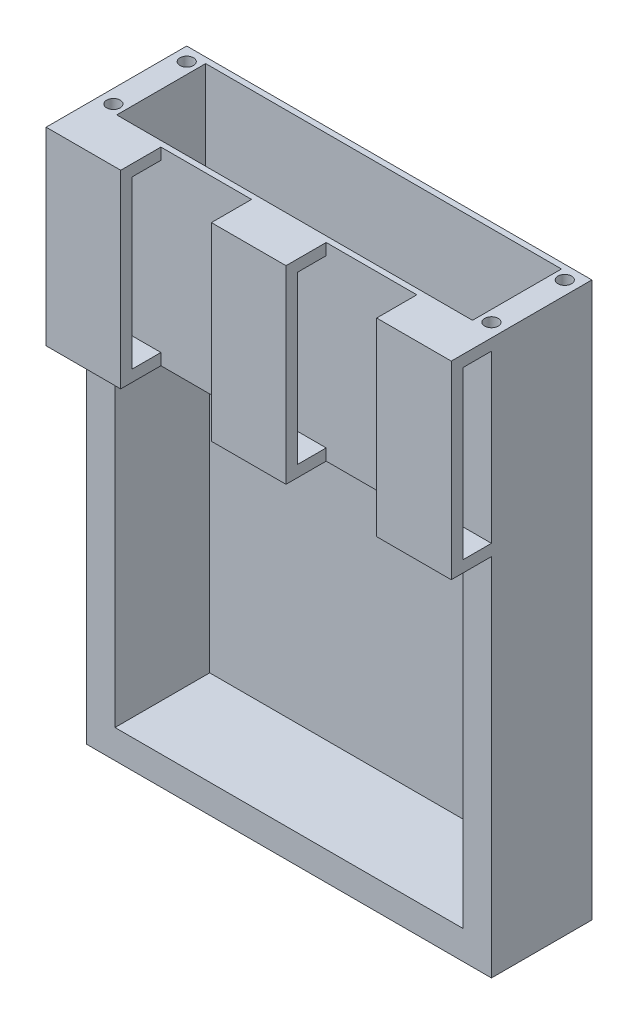
from build123d import *

# Parameters (mm, degrees)
SKETCH1_W           = 89.662
SKETCH1_H           = 22.225
BOSS_EXTRUDE1_DEPTH = 87.122
SKETCH2_W           = 76.962
SKETCH2_H           = 74.422
CUT_EXTRUDE1_DEPTH  = 20.955
SKETCH4_W           = 89.662
SKETCH4_H           = 22.225
SKETCH4_W_2         = 78.74
SKETCH4_H_2         = 19.685
BOSS_EXTRUDE2_DEPTH = 35.56
SKETCH5_R           = 3.175
SKETCH5_R_2         = 1.5
BOSS_EXTRUDE5_DEPTH = 1.27
SKETCH6_R           = 1.5
CUT_EXTRUDE4_DEPTH  = 19.05
SKETCH10_W          = 16.51
SKETCH10_H          = 41.91
BOSS_EXTRUDE4_DEPTH = 8.89
SKETCH11_W          = 6.35
SKETCH11_H          = 36.83
CUT_EXTRUDE8_DEPTH  = 154.571149612


with BuildPart() as part:
    # Sketch1 → Boss-Extrude1 (new body)
    with BuildSketch(Plane(origin=(0, 0, 0), x_dir=(1, 0, 0), z_dir=(0, 1, 0))):
        with Locations((44.831, 11.1125)):
            Rectangle(SKETCH1_W, SKETCH1_H)
    extrude(amount=BOSS_EXTRUDE1_DEPTH)

    # Sketch2 → Cut-Extrude1 (cut)
    with BuildSketch(Plane.XY):
        with Locations((44.831, 43.561)):
            Rectangle(SKETCH2_W, SKETCH2_H)
    extrude(amount=-CUT_EXTRUDE1_DEPTH, mode=Mode.SUBTRACT)

    # Sketch4 → Boss-Extrude2 (add)
    with BuildSketch(Plane(origin=(0, 87.122, 0), x_dir=(1, 0, 0), z_dir=(0, 1, 0))):
        with Locations((44.831, 11.1125)):
            Rectangle(SKETCH4_W, SKETCH4_H)
        with Locations((44.831, 11.1125)):
            Rectangle(SKETCH4_W_2, SKETCH4_H_2, mode=Mode.SUBTRACT)
    extrude(amount=BOSS_EXTRUDE2_DEPTH)

    # Sketch5 → Boss-Extrude5 (add)
    # profile 1 of 4: a face of its own
    with BuildSketch(Plane(origin=(0, 88.392, -1.27), x_dir=(1, 0, 0), z_dir=(0, 0, -1))):
        with Locations((18.161, -26.02738)):
            Circle(SKETCH5_R)
        with Locations((18.161, -26.02738)):
            Circle(SKETCH5_R_2, mode=Mode.SUBTRACT)
    # profile 2 of 4: a face of its own
    with BuildSketch(Plane(origin=(0, 88.392, -1.27), x_dir=(1, 0, 0), z_dir=(0, 0, -1))):
        with Locations((18.161, -5.70738)):
            Circle(SKETCH5_R)
        with Locations((18.161, -5.70738)):
            Circle(SKETCH5_R_2, mode=Mode.SUBTRACT)
    # profile 3 of 4: a face of its own
    with BuildSketch(Plane(origin=(0, 88.392, -1.27), x_dir=(1, 0, 0), z_dir=(0, 0, -1))):
        with Locations((52.451, -5.70738)):
            Circle(SKETCH5_R)
        with Locations((52.451, -5.70738)):
            Circle(SKETCH5_R_2, mode=Mode.SUBTRACT)
    # profile 4 of 4: a face of its own
    with BuildSketch(Plane(origin=(0, 88.392, -1.27), x_dir=(1, 0, 0), z_dir=(0, 0, -1))):
        with Locations((52.451, -26.02738)):
            Circle(SKETCH5_R)
        with Locations((52.451, -26.02738)):
            Circle(SKETCH5_R_2, mode=Mode.SUBTRACT)
    extrude(amount=BOSS_EXTRUDE5_DEPTH)

    # Sketch6 → Cut-Extrude4 (cut)
    with BuildSketch(Plane(origin=(0, 122.682, 0), x_dir=(1, 0, 0), z_dir=(0, 1, 0))):
        with Locations((3, 3)):
            Circle(SKETCH6_R)
        with Locations((3, 19.225)):
            Circle(SKETCH6_R)
        with Locations((86.662, 19.225)):
            Circle(SKETCH6_R)
        with Locations((86.662, 3)):
            Circle(SKETCH6_R)
    extrude(amount=-CUT_EXTRUDE4_DEPTH, mode=Mode.SUBTRACT)

    # Sketch10 → Boss-Extrude4 (add)
    with BuildSketch(Plane.XY):
        with Locations((8.255, 101.727)):
            Rectangle(SKETCH10_W, SKETCH10_H)
        with Locations((81.407, 101.727)):
            Rectangle(SKETCH10_W, SKETCH10_H)
        with Locations((44.831, 101.727)):
            Rectangle(SKETCH10_W, SKETCH10_H)
    extrude(amount=BOSS_EXTRUDE4_DEPTH)

    # Sketch11 → Cut-Extrude8 (cut, through all)
    with BuildSketch(Plane.ZY):
        with Locations((3.175, 101.727)):
            Rectangle(SKETCH11_W, SKETCH11_H)
    extrude(amount=-CUT_EXTRUDE8_DEPTH, mode=Mode.SUBTRACT)


solid = part.part
